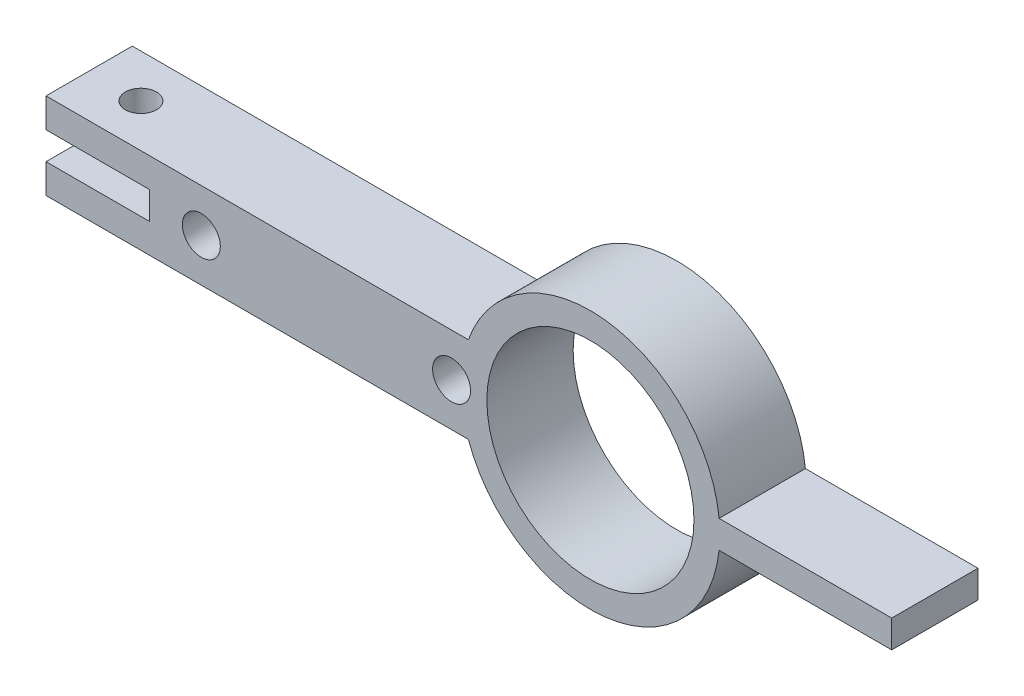
from build123d import *

# Parameters (mm, degrees)
BOSS_EXTRUDE1_DEPTH          = 2.5
TAP_DRILL_FOR_M12X1_5_TAP1_D = 12
HOLE1_D                      = 1.8
SKETCH7_R                    = 1.1
CUT_EXTRUDE1_DEPTH           = 33.805449556


with BuildPart() as part:
    # Sketch1 → Boss-Extrude1 (new, symmetric)
    with BuildSketch(Plane.XY):
        with BuildLine():
            Line((-31.542788725, 2.5), (-7.071067812, 2.5))
            ThreePointArc((-7.071067812, 2.5), (0.871651704, 7.449176015), (7.457211275, 0.8))
            Line((7.457211275, 0.8), (17.457211275, 0.8))
            Line((17.457211275, 0.8), (17.457211275, -0.8))
            Line((17.457211275, -0.8), (7.457211275, -0.8))
            ThreePointArc((7.457211275, -0.8), (0.871651704, -7.449176015), (-7.071067812, -2.5))
            Line((-7.071067812, -2.5), (-31.542788725, -2.5))
            Line((-31.542788725, -2.5), (-31.542788725, -0.8))
            Line((-31.542788725, -0.8), (-25.542788725, -0.8))
            Line((-25.542788725, -0.8), (-25.542788725, 0.8))
            Line((-25.542788725, 0.8), (-31.542788725, 0.8))
            Line((-31.542788725, 0.8), (-31.542788725, 2.5))
        make_face()
    extrude(amount=BOSS_EXTRUDE1_DEPTH, both=True)

    # Tap Drill for M12x1.5 Tap1 (through all)
    with Locations(Plane.XY.offset(2.5)):
        with Locations((0, 0)):
            Hole(TAP_DRILL_FOR_M12X1_5_TAP1_D / 2)

    # Hole1 (through all)
    with Locations(Plane(origin=(0, 2.5, 0), x_dir=(1, 0, 0), z_dir=(0, 1, 0))):
        with Locations((-28.542788725, 0)):
            Hole(HOLE1_D / 2)

    # Sketch7 → Cut-Extrude1 (cut, through all)
    with BuildSketch(Plane.XY.offset(-2.5)):
        with Locations((-8.042788725, 0)):
            Circle(SKETCH7_R)
        with Locations((-22.542788725, 0)):
            Circle(SKETCH7_R)
    extrude(amount=CUT_EXTRUDE1_DEPTH, mode=Mode.SUBTRACT)


solid = part.part
